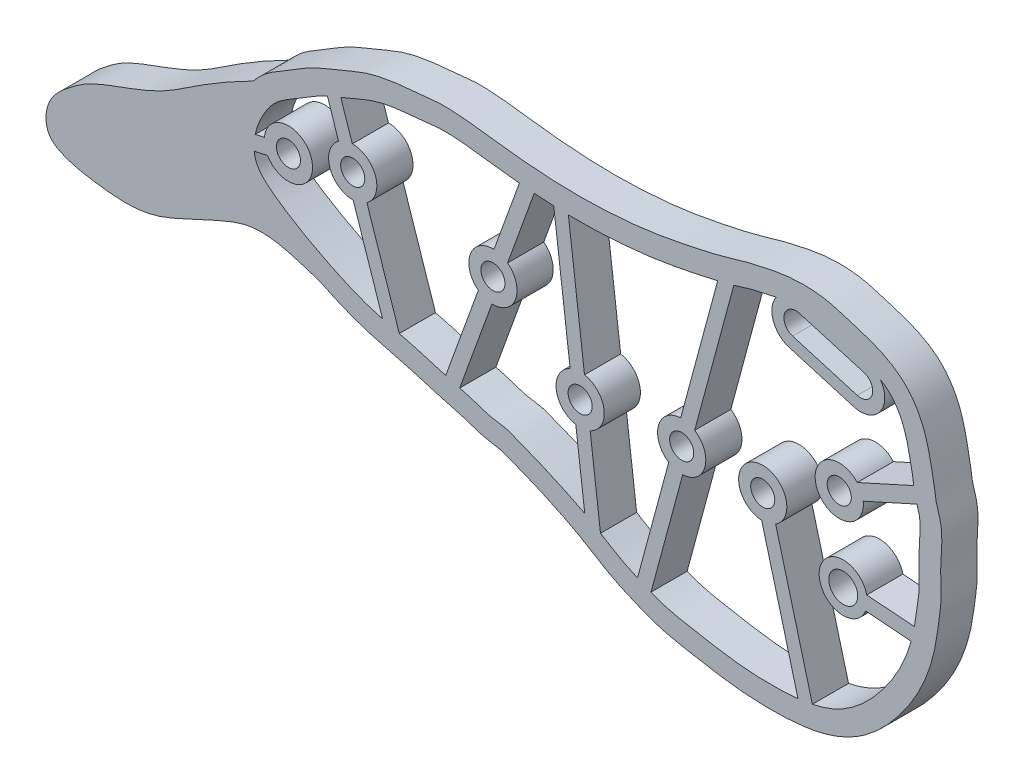
from build123d import *

# Parameters (mm, degrees)
SKETCH1_R           = 1
SKETCH1_R_2         = 1.2
BOSS_EXTRUDE2_DEPTH = 3


with BuildPart() as part:
    # Sketch1 → Boss-Extrude2 (new body)
    with BuildSketch(Plane.XY):
        with BuildLine():
            add(Edge.make_bspline(
                [(-61.194056067, -39.053911589), (-61.122900057, -38.963866602), (-60.786904658, -38.560911725), (-60.00992855, -37.852817537), (-59.003480445, -37.246073809), (-58.174355884, -36.772769635), (-57.327099252, -36.238740499), (-56.35540667, -35.66135915), (-55.216866917, -35.152458018), (-54.286405568, -34.812028793), (-53.431076372, -34.439796518), (-52.429050107, -34.007780979), (-51.255715995, -33.610026962), (-50.071749357, -33.384507888), (-49.045249247, -33.230578357), (-47.828145755, -33.147167352), (-47.12143284, -33.068462338), (-45.839380836, -32.900006373), (-44.653373281, -32.930663695), (-43.568648684, -33.01461399), (-42.157105186, -33.177661456), (-40.509490539, -33.403845956), (-38.545360024, -33.612456224), (-35.94093206, -33.804902845), (-33.340563194, -33.832894429), (-30.756650551, -33.678051185), (-28.794151513, -33.488804917), (-26.920072014, -33.196178819), (-24.950266667, -32.806724177), (-23.349670305, -32.461024841), (-22.265503841, -32.183036418), (-21.649462996, -32.008925624), (-21.209395475, -31.877463318), (-20.70946833, -31.713547895), (-19.878000454, -31.499533225), (-19.141228701, -31.340602421), (-18.028787086, -31.084264266), (-16.522498553, -30.859383902), (-14.928555409, -30.816279827), (-13.481718582, -31.038893243), (-12.630097062, -31.274982312), (-12.133022874, -31.439508337), (-11.641071775, -31.587320169), (-10.892105373, -31.810598932), (-9.867134365, -32.139436087), (-8.567891257, -32.701079375), (-7.251943186, -33.587675734), (-6.207946445, -34.867557457), (-5.559358006, -36.215991163), (-5.24082787, -37.307921777), (-5.059599258, -38.118279873), (-4.942470276, -38.70289265), (-4.858556094, -39.13442909), (-4.776359852, -39.518091384), (-4.6915535, -40.024000382), (-4.639432155, -40.508213848), (-4.581134865, -40.896862992), (-4.482267653, -41.242293302), (-4.281330913, -41.851414392), (-4.120278273, -42.603749583), (-4.074660997, -43.396967897), (-4.117108658, -44.312590413), (-4.178702696, -45.28359228), (-4.199333988, -45.922143371), (-4.160805911, -46.921937766), (-4.150607309, -47.889064192), (-4.224156466, -48.674898147), (-4.293047473, -49.098130962), (-4.340977262, -49.393711969), (-4.399984238, -49.862668025), (-4.482960411, -50.525230204), (-4.595762684, -51.207387585), (-4.778092827, -52.079043066), (-5.185128689, -53.548169326), (-6.014584451, -55.478582768), (-7.340063403, -57.543808702), (-8.997122359, -59.504072782), (-11.088016209, -61.232534578), (-13.707325444, -62.336809017), (-16.294682371, -62.705362225), (-18.682294173, -62.76702155), (-21.128740397, -62.618269445), (-23.078682593, -62.319402154), (-24.577811562, -62.049891002), (-25.688873174, -61.852318013), (-26.886827493, -61.609920851), (-27.955649277, -61.302315773), (-28.763818159, -60.986126793), (-29.289057886, -60.765267196), (-29.791224556, -60.561409915), (-30.356052376, -60.327301192), (-30.951834763, -60.049655806), (-31.695144696, -59.659845141), (-32.562422416, -59.149750555), (-33.529261963, -58.550225406), (-34.725263673, -57.84171359), (-36.296934147, -57.076207611), (-38.008786574, -56.312646995), (-39.304715566, -55.813984606), (-40.305882796, -55.390097629), (-40.653466322, -55.277604183), (-41.043684553, -55.209809435), (-41.681755677, -55.126645), (-42.473969769, -54.928960538), (-43.070529415, -54.716753337), (-43.526200736, -54.559932454), (-43.997111467, -54.424951042), (-44.714816555, -54.236273436), (-45.667463991, -53.970534346), (-47.118242882, -53.540953633), (-48.849380765, -53.028665998), (-51.034512154, -52.526873326), (-53.222917439, -51.811750486), (-54.66605266, -51.161848897), (-55.38305176, -50.817330099), (-55.564813987, -50.728465622)],
                knots=[0.061509283, 0.061509283, 0.061509283, 0.061509283, 0.063462408, 0.0703125, 0.078125, 0.0859375, 0.09375, 0.1015625, 0.109375, 0.1171875, 0.125, 0.1328125, 0.140625, 0.1484375, 0.15625, 0.1640625, 0.171875, 0.1796875, 0.1875, 0.1953125, 0.203125, 0.21875, 0.234375, 0.25, 0.28125, 0.296875, 0.3125, 0.328125, 0.34375, 0.359375, 0.3671875, 0.37109375, 0.375, 0.37890625, 0.3828125, 0.390625, 0.3984375, 0.40625, 0.421875, 0.4296875, 0.43359375, 0.4375, 0.44140625, 0.4453125, 0.453125, 0.4609375, 0.46875, 0.4765625, 0.484375, 0.4921875, 0.49609375, 0.5, 0.50390625, 0.505859375, 0.5078125, 0.51171875, 0.515625, 0.51953125, 0.5234375, 0.52734375, 0.53125, 0.53515625, 0.5390625, 0.546875, 0.5546875, 0.5625, 0.56640625, 0.568359375, 0.5703125, 0.57421875, 0.578125, 0.58203125, 0.5859375, 0.59375, 0.609375, 0.625, 0.640625, 0.65625, 0.671875, 0.6875, 0.703125, 0.71875, 0.734375, 0.7421875, 0.75, 0.7578125, 0.765625, 0.76953125, 0.7734375, 0.77734375, 0.78125, 0.78515625, 0.7890625, 0.796875, 0.8046875, 0.8125, 0.828125, 0.84375, 0.8515625, 0.859375, 0.86328125, 0.8671875, 0.87109375, 0.875, 0.87890625, 0.8828125, 0.88671875, 0.890625, 0.8984375, 0.90625, 0.921875, 0.9375, 0.953125, 0.964598387, 0.968504637, 0.968504637, 0.968504637, 0.968504637], degree=3))
            add(Edge.make_bspline(
                [(-61.194056067, -39.053911589), (-62.625983443, -39.782117613), (-65.208247648, -41.207927678), (-68.839345432, -43.836625902), (-72.315963145, -44.99616078), (-74.989311717, -46.056949571), (-76.781076825, -47.382567236), (-78.474519008, -48.900217936), (-78.467785657, -51.470367992), (-76.487582295, -52.52039994), (-73.889872369, -52.986404927), (-69.801501913, -53.368020358), (-66.606257317, -51.626426159), (-63.716407964, -50.356521847), (-60.481451189, -48.927991213), (-57.324315582, -50.149952512), (-55.564813987, -50.728465622)],
                knots=[0, 0, 0, 0, 0.105045838, 0.193260654, 0.291013929, 0.343614403, 0.380042558, 0.436980025, 0.487582193, 0.515276092, 0.574688612, 0.662804361, 0.775463445, 0.804074948, 0.870737703, 1, 1, 1, 1], degree=3))
        make_face()
        with BuildLine():
            Line((-52.909932857, -43.45754686), (-50.466244706, -50.778646515))
            add(Edge.make_bspline(
                [(-50.466244706, -50.778646515), (-50.925212819, -50.654968292), (-52.044668444, -50.328698359), (-54.837791691, -49.161154752), (-57.660416327, -47.624103177), (-59.877215865, -46.079923146), (-60.914838531, -45.143410981), (-61.096020616, -44.250203792), (-61.115325292, -44.056369829)],
                knots=[0.936573507, 0.936573507, 0.936573507, 0.936573507, 0.946461202, 0.960888988, 1, 1.008418225, 1.024991907, 1.029456568, 1.029456568, 1.029456568, 1.029456568], degree=3))
            Line((-61.115325292, -44.056369829), (-60.005038699, -43.807120701))
            ThreePointArc((-60.005038699, -43.807120701), (-56.324851813, -42.366019586), (-60.267885832, -42.63626145))
            Line((-60.267885832, -42.63626145), (-61.032118191, -42.807824586))
            add(Edge.make_bspline(
                [(-61.032118191, -42.807824586), (-60.893432883, -42.131129315), (-60.42899255, -41.042327102), (-59.277347111, -39.425068122), (-57.33093049, -38.417496572), (-55.918073964, -37.45239384), (-55.088265001, -37.068514938), (-55.048531089, -37.050472879)],
                knots=[0.038991333, 0.038991333, 0.038991333, 0.038991333, 0.054839244, 0.065896336, 0.084165811, 0.104394653, 0.10540813, 0.10540813, 0.10540813, 0.10540813], degree=3))
            Line((-55.048531089, -37.050472879), (-54.117604171, -39.839457527))
            ThreePointArc((-54.117604171, -39.839457527), (-54.841094423, -42.091546374), (-52.909932857, -43.45754686))
        make_face(mode=Mode.SUBTRACT)
        with BuildLine():
            Line((-52.979339238, -39.459519449), (-53.934620098, -36.597572286))
            add(Edge.make_bspline(
                [(-53.934620098, -36.597572286), (-53.805181764, -36.547291984), (-52.813683192, -36.158810704), (-51.283293517, -35.397841224), (-49.535112373, -35.122172896), (-48.307243489, -34.965960399), (-47.299534455, -34.931231662), (-45.979275858, -34.696988474), (-43.965342756, -34.742046733), (-41.654168641, -35.07775382), (-39.858280392, -35.283941089), (-39.126979603, -35.355158959)],
                knots=[0.114679222, 0.114679222, 0.114679222, 0.114679222, 0.117879753, 0.139207419, 0.153885524, 0.158465695, 0.167836402, 0.177147849, 0.189373262, 0.214162697, 0.231144836, 0.231144836, 0.231144836, 0.231144836], degree=3))
            Line((-39.126979603, -35.355158959), (-41.231192381, -41.16735827))
            ThreePointArc((-41.231192381, -41.16735827), (-43.196155188, -42.484272652), (-42.529632355, -44.753873858))
            Line((-42.529632355, -44.753873858), (-45.232412091, -52.219418543))
            add(Edge.make_bspline(
                [(-45.232412091, -52.219418543), (-46.266739729, -51.920273656), (-47.539413377, -51.526844054), (-48.834523287, -51.196368558), (-49.082652911, -51.133688636)],
                knots=[0.898962547, 0.898962547, 0.898962547, 0.898962547, 0.921379228, 0.92668771, 0.92668771, 0.92668771, 0.92668771], degree=3))
            Line((-49.082652911, -51.133688636), (-51.771667925, -43.077608782))
            ThreePointArc((-51.771667925, -43.077608782), (-51.048177672, -40.825519935), (-52.979339238, -39.459519449))
        make_face(mode=Mode.SUBTRACT)
        with Locations((-52.944636048, -41.458533154)):
            Circle(SKETCH1_R, mode=Mode.SUBTRACT)
        with BuildLine():
            add(Edge.make_bspline(
                [(-33.701574079, -56.373878361), (-34.716527389, -55.819696073), (-36.136547352, -55.175539869), (-37.935691728, -54.402528025), (-39.058192294, -53.978741946), (-40.218774221, -53.458363286), (-41.566364691, -53.375884044), (-42.819510708, -52.870953595), (-43.673578677, -52.64939876), (-44.073256511, -52.542771938)],
                knots=[0.813640022, 0.813640022, 0.813640022, 0.813640022, 0.837687832, 0.846032736, 0.854360406, 0.862697319, 0.872259041, 0.882003653, 0.890611946, 0.890611946, 0.890611946, 0.890611946], degree=3))
            Line((-44.073256511, -52.542771938), (-41.401300645, -45.162368108))
            ThreePointArc((-41.401300645, -45.162368108), (-39.436337838, -43.845453727), (-40.102860671, -41.575852521))
            Line((-40.102860671, -41.575852521), (-37.889750329, -35.462859319))
            add(Edge.make_bspline(
                [(-37.889750329, -35.462859319), (-37.496248238, -35.49284046), (-36.95781296, -35.528021583), (-36.418816982, -35.554170511), (-36.274021209, -35.56053517)],
                knots=[0.240713182, 0.240713182, 0.240713182, 0.240713182, 0.249834871, 0.253184375, 0.253184375, 0.253184375, 0.253184375], degree=3))
            Line((-36.274021209, -35.56053517), (-34.913680083, -46.566882546))
            ThreePointArc((-34.913680083, -46.566882546), (-36.068490508, -48.631284446), (-34.445805201, -50.352398828))
            Line((-34.445805201, -50.352398828), (-33.701574079, -56.373878361))
        make_face(mode=Mode.SUBTRACT)
        with BuildLine():
            add(Edge.make_bspline(
                [(-29.326600138, -58.804932077), (-29.497869267, -58.733335355), (-30.568666656, -58.272114621), (-31.55882775, -57.648488399), (-32.398278627, -57.135752187)],
                knots=[0.778908076, 0.778908076, 0.778908076, 0.778908076, 0.782770016, 0.803185723, 0.803185723, 0.803185723, 0.803185723], degree=3))
            Line((-32.398278627, -57.135752187), (-33.254867101, -50.205203576))
            ThreePointArc((-33.254867101, -50.205203576), (-32.100056676, -48.140801676), (-33.722741983, -46.419687294))
            Line((-33.722741983, -46.419687294), (-35.06022202, -35.59830609))
            add(Edge.make_bspline(
                [(-35.06022202, -35.59830609), (-34.31675102, -35.6118162), (-33.377104129, -35.606353463), (-31.989235566, -35.553986577), (-30.888681612, -35.488679717), (-29.580808871, -35.371437263), (-27.643342783, -35.15780752), (-25.359873335, -34.730077136), (-23.484856168, -34.33660716), (-22.677861939, -34.141696104)],
                knots=[0.262539251, 0.262539251, 0.262539251, 0.262539251, 0.279723295, 0.284249287, 0.294647384, 0.305205595, 0.314605533, 0.339694174, 0.358901091, 0.358901091, 0.358901091, 0.358901091], degree=3))
            Line((-22.677861939, -34.141696104), (-25.746720073, -45.525506094))
            ThreePointArc((-25.746720073, -45.525506094), (-27.594214026, -47.002702227), (-26.739544598, -49.208350089))
            Line((-26.739544598, -49.208350089), (-29.326600138, -58.804932077))
        make_face(mode=Mode.SUBTRACT)
        with BuildLine():
            add(Edge.make_bspline(
                [(-16.017972483, -60.821563745), (-16.209485948, -60.842943521), (-16.761263614, -60.89386698), (-17.45738343, -60.925530561), (-18.450390865, -60.93967141), (-19.983011157, -60.912707914), (-22.161696726, -60.66099592), (-24.802454275, -60.178394869), (-26.827825105, -59.818466058), (-27.977238564, -59.360885447), (-28.208066869, -59.266041756)],
                knots=[0.684743352, 0.684743352, 0.684743352, 0.684743352, 0.688720491, 0.696193702, 0.699273238, 0.709375305, 0.728070074, 0.744780937, 0.765338705, 0.770526623, 0.770526623, 0.770526623, 0.770526623], degree=3))
            Line((-28.208066869, -59.266041756), (-25.580907598, -49.520696534))
            ThreePointArc((-25.580907598, -49.520696534), (-23.733413645, -48.043500401), (-24.588083073, -45.837852539))
            Line((-24.588083073, -45.837852539), (-21.340729526, -33.791920752))
            add(Edge.make_bspline(
                [(-21.340729526, -33.791920752), (-21.113370648, -33.727320053), (-20.681619661, -33.599099018), (-19.981167547, -33.371324186), (-19.07653807, -33.176676236), (-18.326720718, -32.992771616), (-17.861519172, -32.900111555), (-17.819333667, -32.891891629)],
                knots=[0.369559397, 0.369559397, 0.369559397, 0.369559397, 0.375025142, 0.379970152, 0.386561709, 0.39648446, 0.397474399, 0.397474399, 0.397474399, 0.397474399], degree=3))
            ThreePointArc((-17.819333667, -32.891891629), (-18.076653097, -34.703725269), (-16.752088427, -35.966453609))
            Line((-16.752088427, -35.966453609), (-11.388299915, -37.545585318))
            ThreePointArc((-11.388299915, -37.545585318), (-9.19777901, -36.791979559), (-9.188229866, -34.475470918))
            add(Edge.make_bspline(
                [(-9.188229866, -34.475470918), (-8.911386809, -34.647021387), (-8.155723837, -35.216564803), (-7.064960828, -36.942347809), (-6.787869597, -38.711398115), (-6.495376248, -40.093089606), (-6.45651198, -40.466160117), (-6.422944896, -40.725056729)],
                knots=[0.462896674, 0.462896674, 0.462896674, 0.462896674, 0.469592018, 0.482500714, 0.5040008, 0.5064167, 0.511856122, 0.511856122, 0.511856122, 0.511856122], degree=3))
            Line((-6.422944896, -40.725056729), (-11.10720983, -42.846264389))
            ThreePointArc((-11.10720983, -42.846264389), (-14.418313263, -45.004305629), (-10.612194746, -43.939406679))
            Line((-10.612194746, -43.939406679), (-6.153085375, -41.920157749))
            add(Edge.make_bspline(
                [(-6.153085375, -41.920157749), (-6.112147791, -42.050930681), (-5.938128897, -42.60237619), (-5.856693497, -43.21307599), (-5.954169854, -44.844023923), (-6.037801364, -46.299333731), (-5.87978281, -47.738839088), (-6.140874321, -49.206261935), (-6.226327922, -50.031726774), (-6.32773412, -50.647005839), (-6.360040002, -50.822991357)],
                knots=[0.520264994, 0.520264994, 0.520264994, 0.520264994, 0.52310444, 0.532522123, 0.536639379, 0.545132913, 0.566484196, 0.569736842, 0.578233294, 0.581710466, 0.581710466, 0.581710466, 0.581710466], degree=3))
            Line((-6.360040002, -50.822991357), (-10.318372018, -50.526352942))
            ThreePointArc((-10.318372018, -50.526352942), (-14.258762094, -50.832741553), (-10.408048863, -51.722997443))
            Line((-10.408048863, -51.722997443), (-6.63059842, -52.006080548))
            add(Edge.make_bspline(
                [(-6.63059842, -52.006080548), (-7.088854787, -53.664675299), (-8.627575964, -56.611789917), (-11.772771304, -59.766624996), (-14.163084678, -60.496665622), (-14.825927938, -60.634467333)],
                knots=[0.589775384, 0.589775384, 0.589775384, 0.589775384, 0.624863979, 0.662471395, 0.676446008, 0.676446008, 0.676446008, 0.676446008], degree=3))
            Line((-14.825927938, -60.634467333), (-17.872396226, -49.211244444))
            ThreePointArc((-17.872396226, -49.211244444), (-19.458771439, -45.591304994), (-19.031871191, -49.520465733))
            Line((-19.031871191, -49.520465733), (-16.017972483, -60.821563745))
        make_face(mode=Mode.SUBTRACT)
        with Locations((-41.316246513, -43.164863189)):
            Circle(SKETCH1_R, mode=Mode.SUBTRACT)
        with Locations((-34.084273592, -48.386043061)):
            Circle(SKETCH1_R, mode=Mode.SUBTRACT)
        with Locations((-25.663813836, -47.523101314)):
            Circle(SKETCH1_R, mode=Mode.SUBTRACT)
        with Locations((-18.94357916, -47.523101314)):
            Circle(SKETCH1_R, mode=Mode.SUBTRACT)
        with Locations((-12.265037767, -50.982151765)):
            Circle(SKETCH1_R_2, mode=Mode.SUBTRACT)
        with Locations((-12.597033531, -44.179563098)):
            Circle(SKETCH1_R, mode=Mode.SUBTRACT)
        with Locations((-58.275615444, -42.803948079)):
            Circle(SKETCH1_R, mode=Mode.SUBTRACT)
        with BuildLine():
            Line((-15.904825619, -33.088581872), (-10.541037107, -34.667713581))
            ThreePointArc((-10.541037107, -34.667713581), (-9.864167464, -35.909425096), (-11.105878979, -36.586294739))
            Line((-11.105878979, -36.586294739), (-16.469667491, -35.00716303))
            ThreePointArc((-16.469667491, -35.00716303), (-17.146537134, -33.765451515), (-15.904825619, -33.088581872))
        make_face(mode=Mode.SUBTRACT)
    extrude(amount=BOSS_EXTRUDE2_DEPTH)


solid = part.part
